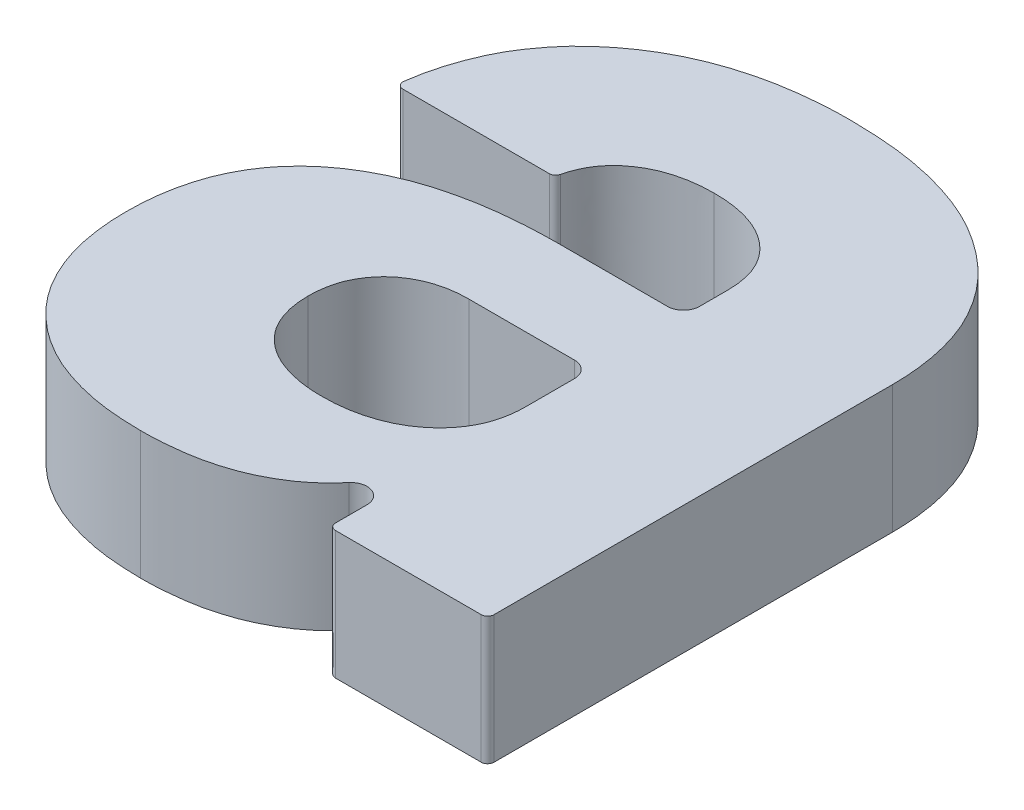
from build123d import *

# Parameters (mm, degrees)
BOSS_EXTRUDE1_DEPTH = 20
FILLET1_R           = 2.5
FILLET2_R           = 1


with BuildPart() as part:
    # Sketch1 → Boss-Extrude1 (new body)
    with BuildSketch(Plane(origin=(0, 0, 0), x_dir=(1, 0, 0), z_dir=(0, 1, 0))):
        with BuildLine():
            Line((66.091954023, 56.331747919), (46.571541815, 56.331747919))
            add(Edge.make_bspline(
                [(8.397740785, 26.877724931), (8.381769329, 29.119999718), (8.676910477, 32.415004299), (9.717194462, 36.590359266), (10.78337457, 39.44970825), (12.187088577, 42.087473971), (13.872052466, 44.541673052), (15.908347994, 46.751956633), (18.219872175, 48.771713505), (20.838790896, 50.551844715), (23.717934081, 52.112237122), (26.86925659, 53.437295898), (30.294482405, 54.480353234), (33.983645448, 55.333932101), (39.424871587, 56.131054408), (43.66876661, 56.318212865), (46.571541815, 56.331747919)],
                knots=[0, 0, 0, 0, 0.12291379, 0.180339793, 0.235499338, 0.289773006, 0.343774092, 0.398255064, 0.454088605, 0.511726576, 0.571487453, 0.633371274, 0.698809418, 0.767557443, 0.840803156, 1, 1, 1, 1], degree=3))
            add(Edge.make_bspline(
                [(39.214229092, -1.709274673), (36.964913555, -1.683588337), (33.647160336, -1.527674572), (29.414394285, -0.671565366), (26.497881102, 0.173386984), (23.745711871, 1.228567737), (21.198804459, 2.577952867), (18.819526906, 4.137862952), (16.670635559, 5.962168525), (14.708138466, 7.952232742), (13.011376277, 10.147716427), (11.592862343, 12.522777818), (10.425684109, 15.065060488), (9.500606462, 17.776982961), (8.64107245, 21.713358078), (8.376146251, 24.785642977), (8.397740785, 26.877724931)],
                knots=[0, 0, 0, 0, 0.14219582, 0.208634656, 0.272136368, 0.33369187, 0.394304617, 0.453715604, 0.512906719, 0.571877142, 0.629839371, 0.687580915, 0.74611442, 0.806107792, 0.868065758, 1, 1, 1, 1], degree=3))
            add(Edge.make_bspline(
                [(66.958901986, 18.337275198), (66.799868301, 16.884084421), (66.360251156, 14.670497056), (65.270026404, 11.86110118), (64.195632072, 9.804777918), (62.879341634, 7.885931932), (61.29687079, 6.12530988), (59.51979712, 4.490533641), (57.535868129, 3.026128372), (55.365684422, 1.772738779), (53.064906123, 0.664422399), (50.588426951, -0.18379256), (47.979266838, -0.900002913), (44.174655992, -1.50783148), (41.228661841, -1.724359639), (39.214229092, -1.709274673)],
                knots=[0, 0, 0, 0, 0.116226936, 0.178119995, 0.238865389, 0.300192565, 0.362466934, 0.426546731, 0.491761716, 0.557923532, 0.62542176, 0.694311721, 0.765605807, 0.840134919, 1, 1, 1, 1], degree=3))
            Line((66.958901986, 18.337275198), (66.958901986, 15.408252619))
            Line((66.958901986, 15.408252619), (66.958901986, 15.316291088))
            Line((66.958901986, 15.316291088), (66.958901986, 8.465e-06))
            Line((66.958901986, 8.465e-06), (91.780618312, 8.465e-06))
            Line((91.780618312, 8.465e-06), (91.780618312, 63.342251288))
            add(Edge.make_bspline(
                [(52.739793896, 95.892786365), (55.584173363, 95.859333186), (59.767770622, 95.669910482), (65.133887268, 94.714020074), (68.833803902, 93.758866824), (72.297868508, 92.511270916), (75.540253624, 91.011904617), (78.517882369, 89.179537744), (81.280079947, 87.133886131), (83.745403822, 84.839265591), (85.912786313, 82.339981541), (87.707197563, 79.630158123), (89.232151439, 76.755528184), (90.354950079, 73.665703671), (91.477728586, 69.215342723), (91.770921607, 65.715202765), (91.780618312, 63.342251288)],
                knots=[0, 0, 0, 0, 0.149032899, 0.218375964, 0.284934987, 0.34877142, 0.410827759, 0.471527079, 0.531422686, 0.590437231, 0.647434754, 0.704126747, 0.760181033, 0.817335611, 0.875715427, 1, 1, 1, 1], degree=3))
            add(Edge.make_bspline(
                [(12.336504162, 65.076298058), (12.555255592, 67.361274355), (13.234972871, 70.697142719), (14.767714432, 74.892546003), (16.128168791, 77.834243489), (17.882228125, 80.5440029), (19.853410828, 83.113317409), (22.151599378, 85.476829731), (24.738703742, 87.623086406), (27.542460458, 89.57390137), (30.571176435, 91.271586093), (33.788564091, 92.705900725), (37.207699002, 93.867882934), (40.808486161, 94.791563483), (45.992393041, 95.650223799), (50.006512543, 95.910795598), (52.739793896, 95.892786365)],
                knots=[0, 0, 0, 0, 0.122516832, 0.180678096, 0.23826666, 0.295145337, 0.352647757, 0.410955902, 0.470739018, 0.531891685, 0.593088841, 0.655852654, 0.719712633, 0.785692673, 0.8541185, 1, 1, 1, 1], degree=3))
            Line((12.336504162, 65.076298058), (37.158145065, 65.076298058))
            add(Edge.make_bspline(
                [(51.872770511, 75.331946096), (50.027254685, 75.346605825), (47.344775572, 75.023949253), (44.031867461, 73.879242065), (41.934519068, 72.653102728), (40.115212701, 71.175654508), (38.214102601, 68.7617512), (37.428266803, 66.575489361), (37.158145065, 65.076298058)],
                knots=[0, 0, 0, 0, 0.282230561, 0.409765494, 0.53377554, 0.652237824, 0.766533799, 1, 1, 1, 1], degree=3))
            add(Edge.make_bspline(
                [(66.091954023, 63.342251288), (66.085212878, 65.017333731), (65.67164042, 67.538148717), (63.977257215, 70.399120184), (62.262060556, 72.169706935), (60.153851422, 73.595690637), (56.71874776, 75.002725792), (53.843936642, 75.350426588), (51.872770511, 75.331946096)],
                knots=[0, 0, 0, 0, 0.24114674, 0.35516784, 0.47146746, 0.591555946, 0.717224943, 1, 1, 1, 1], degree=3))
            Line((66.091954023, 63.342251288), (66.091954023, 56.331747919))
        make_face()
        with BuildLine():
            Line((66.091954023, 41.79052715), (66.091954023, 31.683511692))
            add(Edge.make_bspline(
                [(48.801030519, 17.117518827), (51.123373907, 17.087632327), (54.52050874, 17.575176732), (58.644879984, 19.265882347), (61.253715521, 21.032711666), (63.398917981, 23.206787097), (65.551826531, 26.632015101), (66.107463707, 29.671955673), (66.091954023, 31.683511692)],
                knots=[0, 0, 0, 0, 0.274902116, 0.401207441, 0.525236946, 0.645639047, 0.760772604, 1, 1, 1, 1], degree=3))
            add(Edge.make_bspline(
                [(34.061632977, 29.627427665), (34.049912968, 27.856060938), (34.494666122, 25.233813788), (36.195947186, 22.212333568), (37.963585576, 20.375065647), (40.148735556, 18.89467247), (43.741347146, 17.460545805), (46.735280322, 17.081877815), (48.801030519, 17.117518827)],
                knots=[0, 0, 0, 0, 0.243842335, 0.356155068, 0.471738988, 0.591017875, 0.716185508, 1, 1, 1, 1], degree=3))
            add(Edge.make_bspline(
                [(47.091755846, 41.79052715), (45.305677922, 41.818968819), (42.678478302, 41.436533532), (39.568825259, 39.976763484), (37.603383039, 38.525746422), (36.038174004, 36.692560536), (34.41611374, 33.826252081), (34.075394418, 31.298780623), (34.061632977, 29.627427665)],
                knots=[0, 0, 0, 0, 0.267691497, 0.389329598, 0.511199828, 0.630382905, 0.747673092, 1, 1, 1, 1], degree=3))
            Line((47.091755846, 41.79052715), (66.091954023, 41.79052715))
        make_face(mode=Mode.SUBTRACT)
    extrude(amount=-BOSS_EXTRUDE1_DEPTH)

    # Fillet1
    fillet1_edges = [part.edges().sort_by_distance(p)[0] for p in [
        (66.091954023, -10, -56.331747919),
        (66.091954023, -10, -41.79052715),
        (66.958901986, -10, -18.337275198),
    ]]
    fillet(fillet1_edges, radius=FILLET1_R)

    # Fillet2
    fillet2_edges = [part.edges().sort_by_distance(p)[0] for p in [
        (91.780618312, -10, -8.465e-06),
        (66.958901986, -10, -8.465e-06),
        (12.336504162, -10, -65.076298058),
        (37.158145065, -10, -65.076298058),
    ]]
    fillet(fillet2_edges, radius=FILLET2_R)


solid = part.part
